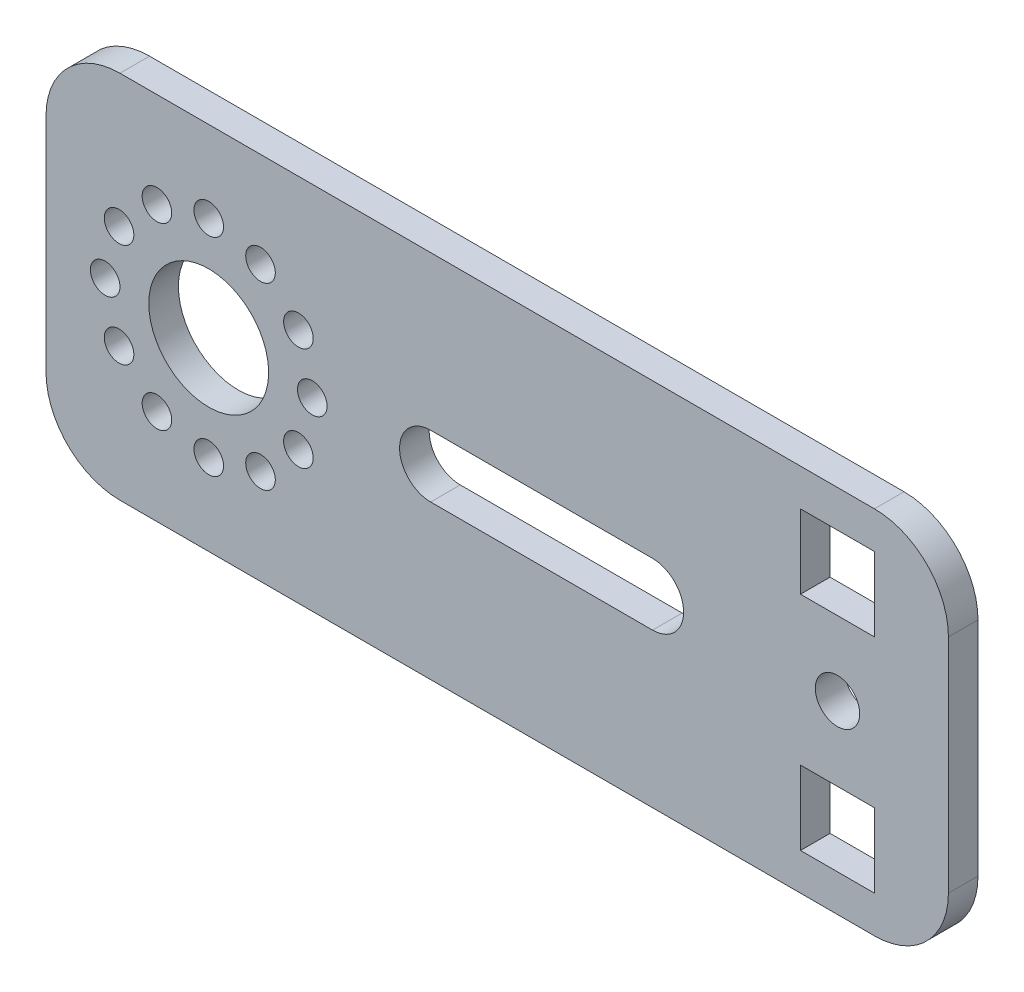
from build123d import *

# Parameters (mm, degrees)
BOSS_EXTRU_1_START       = -2
BOSS_EXTRU_1_OUTLINE_W   = 61
BOSS_EXTRU_1_OUTLINE_H   = 25
BOSS_EXTRU_1_OUTLINE_W_2 = 5
BOSS_EXTRU_1_OUTLINE_H_2 = 5
BOSS_EXTRU_1_OUTLINE_R   = 1
BOSS_EXTRU_1_OUTLINE_R_2 = 1.5
BOSS_EXTRU_1_OUTLINE_R_3 = 4.05
BOSS_EXTRU_1_DEPTH       = 2
CONG_1_R                 = 5


# Read off the part's stored shape, not the designer's step: Boss.-Extru.1
with BuildPart() as part:
    # Boss.-Extru.1 outline → Boss.-Extru.1 (new body)
    with BuildSketch(Plane(origin=(0, 0, 0), x_dir=(-1, 0, 0), z_dir=(0, 0, -1)).offset(BOSS_EXTRU_1_START)):
        with Locations((-30.5, 0)):
            Rectangle(BOSS_EXTRU_1_OUTLINE_W, BOSS_EXTRU_1_OUTLINE_H)
        with Locations((-53.5, -7.5)):
            Rectangle(BOSS_EXTRU_1_OUTLINE_W_2, BOSS_EXTRU_1_OUTLINE_H_2, mode=Mode.SUBTRACT)
        with Locations((-11, -7)):
            Circle(BOSS_EXTRU_1_OUTLINE_R, mode=Mode.SUBTRACT)
        with Locations((-17.062177826, -3.5)):
            Circle(BOSS_EXTRU_1_OUTLINE_R, mode=Mode.SUBTRACT)
        with Locations((-14.5, -6.062177826)):
            Circle(BOSS_EXTRU_1_OUTLINE_R, mode=Mode.SUBTRACT)
        with Locations((-7.5, -6.062177826)):
            Circle(BOSS_EXTRU_1_OUTLINE_R, mode=Mode.SUBTRACT)
        with Locations((-4.937822174, -3.5)):
            Circle(BOSS_EXTRU_1_OUTLINE_R, mode=Mode.SUBTRACT)
        with Locations((-53.5, 0)):
            Circle(BOSS_EXTRU_1_OUTLINE_R_2, mode=Mode.SUBTRACT)
        with BuildLine():
            ThreePointArc((-26, 2.1), (-23.9, 0), (-26, -2.1))
            Line((-26, -2.1), (-41, -2.1))
            ThreePointArc((-41, -2.1), (-43.1, 0), (-41, 2.1))
            Line((-41, 2.1), (-26, 2.1))
        make_face(mode=Mode.SUBTRACT)
        with Locations((-53.5, 7.5)):
            Rectangle(BOSS_EXTRU_1_OUTLINE_W_2, BOSS_EXTRU_1_OUTLINE_H_2, mode=Mode.SUBTRACT)
        with Locations((-18, 0)):
            Circle(BOSS_EXTRU_1_OUTLINE_R, mode=Mode.SUBTRACT)
        with Locations((-17.062177826, 3.5)):
            Circle(BOSS_EXTRU_1_OUTLINE_R, mode=Mode.SUBTRACT)
        with Locations((-11, 0)):
            Circle(BOSS_EXTRU_1_OUTLINE_R_3, mode=Mode.SUBTRACT)
        with Locations((-4, 0)):
            Circle(BOSS_EXTRU_1_OUTLINE_R, mode=Mode.SUBTRACT)
        with Locations((-14.5, 6.062177826)):
            Circle(BOSS_EXTRU_1_OUTLINE_R, mode=Mode.SUBTRACT)
        with Locations((-4.937822174, 3.5)):
            Circle(BOSS_EXTRU_1_OUTLINE_R, mode=Mode.SUBTRACT)
        with Locations((-7.5, 6.062177826)):
            Circle(BOSS_EXTRU_1_OUTLINE_R, mode=Mode.SUBTRACT)
        with Locations((-11, 7)):
            Circle(BOSS_EXTRU_1_OUTLINE_R, mode=Mode.SUBTRACT)
    extrude(amount=BOSS_EXTRU_1_DEPTH)

    # Congé1
    cong_1_edges = [part.edges().sort_by_distance(p)[0] for p in [
        (61, 12.5, 1),
        (0, 12.5, 1),
        (0, -12.5, 1),
        (61, -12.5, 1),
    ]]
    fillet(cong_1_edges, radius=CONG_1_R)


solid = part.part
